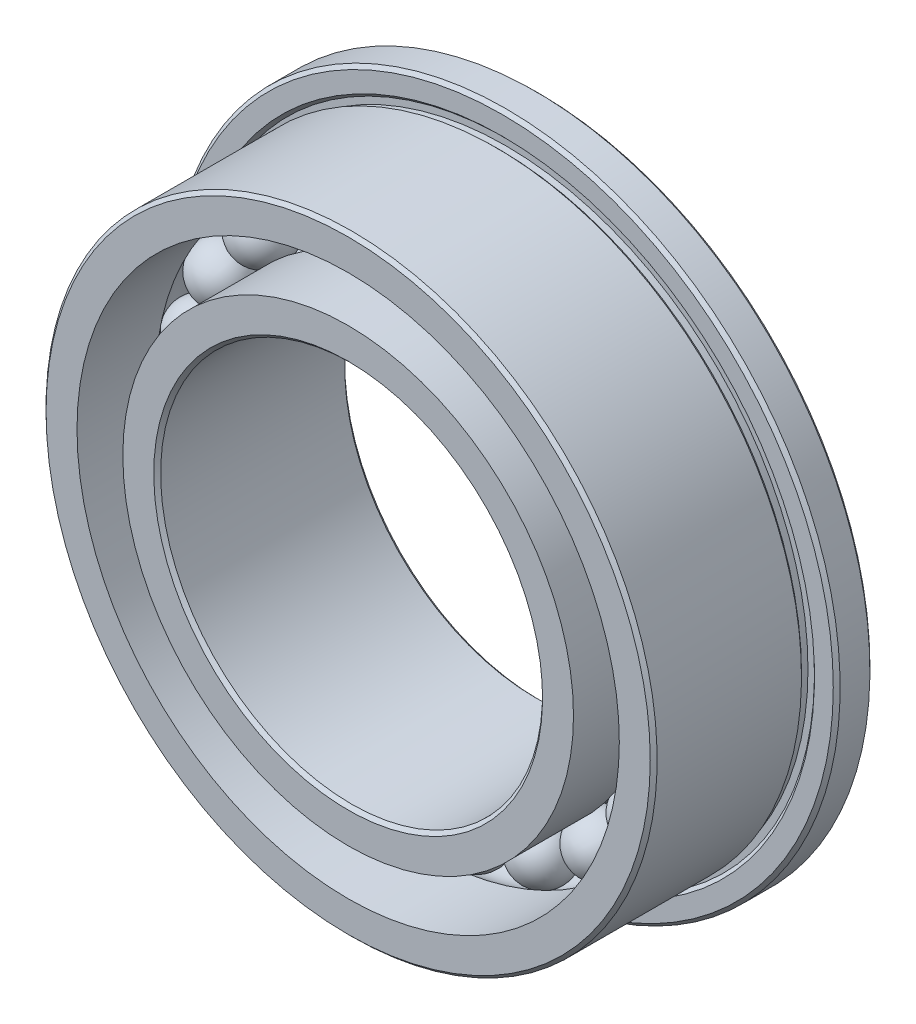
from build123d import *

# Parameters (mm, degrees)
FILLET1_SIZE      = 0.0714375
FILLET2_SIZE      = 0.0714375
CIRPATTERN3_COUNT = 23


with BuildPart() as part:
    # Sketch2 → Revolve1 (revolve)
    with BuildSketch(Plane(origin=(0, 0, 0), x_dir=(0, 0, -1), z_dir=(1, 0, 0))):
        with BuildLine():
            Line((1.984375, 6.9469), (1.222375, 6.9469))
            Line((1.222375, 6.9469), (1.222375, 6.484703842))
            Line((1.222375, 6.484703842), (1.289726921, 6.417351921))
            Line((1.289726921, 6.417351921), (1.289726921, 6.282648079))
            Line((1.289726921, 6.282648079), (1.155023079, 6.282648079))
            Line((1.155023079, 6.282648079), (1.087671158, 6.35))
            Line((1.087671158, 6.35), (-1.984375, 6.35))
            Line((-1.984375, 6.35), (-1.984375, 5.635625))
            Line((-1.984375, 5.635625), (-0.3571875, 5.635625))
            ThreePointArc((-0.3571875, 5.635625), (0, 5.7546875), (0.3571875, 5.635625))
            Line((0.3571875, 5.635625), (1.984375, 5.635625))
            Line((1.984375, 5.635625), (1.984375, 6.9469))
        make_face()
        with BuildLine():
            Line((1.984375, 3.96875), (-1.984375, 3.96875))
            Line((-1.984375, 3.96875), (-1.984375, 4.683125))
            Line((-1.984375, 4.683125), (-0.3571875, 4.683125))
            ThreePointArc((-0.3571875, 4.683125), (0, 4.5640625), (0.3571875, 4.683125))
            Line((0.3571875, 4.683125), (1.984375, 4.683125))
            Line((1.984375, 4.683125), (1.984375, 3.96875))
        make_face()
    revolve(axis=Axis((0, 0, 0), (0, 0, -1)))

    # Fillet1
    fillet1_edges = [part.edges().sort_by_distance(p)[0] for p in [
        (0, -6.9469, -1.984375),
        (0, -6.9469, -1.222375),
        (0, -6.35, 1.984375),
    ]]
    chamfer(fillet1_edges, length=FILLET1_SIZE)

    # Fillet2
    fillet2_edges = [part.edges().sort_by_distance(p)[0] for p in [
        (0, -3.96875, -1.984375),
        (0, -3.96875, 1.984375),
    ]]
    chamfer(fillet2_edges, length=FILLET2_SIZE)


with BuildPart() as body_2:
    # Sketch7 → Revolve3 (revolve)
    with BuildSketch(Plane.XY):
        with BuildLine():
            Line((0, 5.7546875), (0, 4.5640625))
            ThreePointArc((0, 4.5640625), (-0.5953125, 5.159375), (0, 5.7546875))
        make_face()
    revolve(axis=Axis((0, 5.7546875, 0), (0, -1, 0)))


with BuildPart() as cirpattern3_1:
    # CirPattern3: pattern copy
    add(body_2.part.rotate(Axis((0, 0, 0), (0, 0, -1)), 1 * 360 / CIRPATTERN3_COUNT))


with BuildPart() as cirpattern3_2:
    # CirPattern3: pattern copy
    add(body_2.part.rotate(Axis((0, 0, 0), (0, 0, -1)), 2 * 360 / CIRPATTERN3_COUNT))


with BuildPart() as cirpattern3_3:
    # CirPattern3: pattern copy
    add(body_2.part.rotate(Axis((0, 0, 0), (0, 0, -1)), 3 * 360 / CIRPATTERN3_COUNT))


with BuildPart() as cirpattern3_4:
    # CirPattern3: pattern copy
    add(body_2.part.rotate(Axis((0, 0, 0), (0, 0, -1)), 4 * 360 / CIRPATTERN3_COUNT))


with BuildPart() as cirpattern3_5:
    # CirPattern3: pattern copy
    add(body_2.part.rotate(Axis((0, 0, 0), (0, 0, -1)), 5 * 360 / CIRPATTERN3_COUNT))


with BuildPart() as cirpattern3_6:
    # CirPattern3: pattern copy
    add(body_2.part.rotate(Axis((0, 0, 0), (0, 0, -1)), 6 * 360 / CIRPATTERN3_COUNT))


with BuildPart() as cirpattern3_7:
    # CirPattern3: pattern copy
    add(body_2.part.rotate(Axis((0, 0, 0), (0, 0, -1)), 7 * 360 / CIRPATTERN3_COUNT))


with BuildPart() as cirpattern3_8:
    # CirPattern3: pattern copy
    add(body_2.part.rotate(Axis((0, 0, 0), (0, 0, -1)), 8 * 360 / CIRPATTERN3_COUNT))


with BuildPart() as cirpattern3_9:
    # CirPattern3: pattern copy
    add(body_2.part.rotate(Axis((0, 0, 0), (0, 0, -1)), 9 * 360 / CIRPATTERN3_COUNT))


with BuildPart() as cirpattern3_10:
    # CirPattern3: pattern copy
    add(body_2.part.rotate(Axis((0, 0, 0), (0, 0, -1)), 10 * 360 / CIRPATTERN3_COUNT))


with BuildPart() as cirpattern3_11:
    # CirPattern3: pattern copy
    add(body_2.part.rotate(Axis((0, 0, 0), (0, 0, -1)), 11 * 360 / CIRPATTERN3_COUNT))


with BuildPart() as cirpattern3_12:
    # CirPattern3: pattern copy
    add(body_2.part.rotate(Axis((0, 0, 0), (0, 0, -1)), 12 * 360 / CIRPATTERN3_COUNT))


with BuildPart() as cirpattern3_13:
    # CirPattern3: pattern copy
    add(body_2.part.rotate(Axis((0, 0, 0), (0, 0, -1)), 13 * 360 / CIRPATTERN3_COUNT))


with BuildPart() as cirpattern3_14:
    # CirPattern3: pattern copy
    add(body_2.part.rotate(Axis((0, 0, 0), (0, 0, -1)), 14 * 360 / CIRPATTERN3_COUNT))


with BuildPart() as cirpattern3_15:
    # CirPattern3: pattern copy
    add(body_2.part.rotate(Axis((0, 0, 0), (0, 0, -1)), 15 * 360 / CIRPATTERN3_COUNT))


with BuildPart() as cirpattern3_16:
    # CirPattern3: pattern copy
    add(body_2.part.rotate(Axis((0, 0, 0), (0, 0, -1)), 16 * 360 / CIRPATTERN3_COUNT))


with BuildPart() as cirpattern3_17:
    # CirPattern3: pattern copy
    add(body_2.part.rotate(Axis((0, 0, 0), (0, 0, -1)), 17 * 360 / CIRPATTERN3_COUNT))


with BuildPart() as cirpattern3_18:
    # CirPattern3: pattern copy
    add(body_2.part.rotate(Axis((0, 0, 0), (0, 0, -1)), 18 * 360 / CIRPATTERN3_COUNT))


with BuildPart() as cirpattern3_19:
    # CirPattern3: pattern copy
    add(body_2.part.rotate(Axis((0, 0, 0), (0, 0, -1)), 19 * 360 / CIRPATTERN3_COUNT))


with BuildPart() as cirpattern3_20:
    # CirPattern3: pattern copy
    add(body_2.part.rotate(Axis((0, 0, 0), (0, 0, -1)), 20 * 360 / CIRPATTERN3_COUNT))


with BuildPart() as cirpattern3_21:
    # CirPattern3: pattern copy
    add(body_2.part.rotate(Axis((0, 0, 0), (0, 0, -1)), 21 * 360 / CIRPATTERN3_COUNT))


with BuildPart() as cirpattern3_22:
    # CirPattern3: pattern copy
    add(body_2.part.rotate(Axis((0, 0, 0), (0, 0, -1)), 22 * 360 / CIRPATTERN3_COUNT))


solid = Compound([part.part, body_2.part, cirpattern3_1.part, cirpattern3_2.part, cirpattern3_3.part, cirpattern3_4.part, cirpattern3_5.part, cirpattern3_6.part, cirpattern3_7.part, cirpattern3_8.part, cirpattern3_9.part, cirpattern3_10.part, cirpattern3_11.part, cirpattern3_12.part, cirpattern3_13.part, cirpattern3_14.part, cirpattern3_15.part, cirpattern3_16.part, cirpattern3_17.part, cirpattern3_18.part, cirpattern3_19.part, cirpattern3_20.part, cirpattern3_21.part, cirpattern3_22.part])
